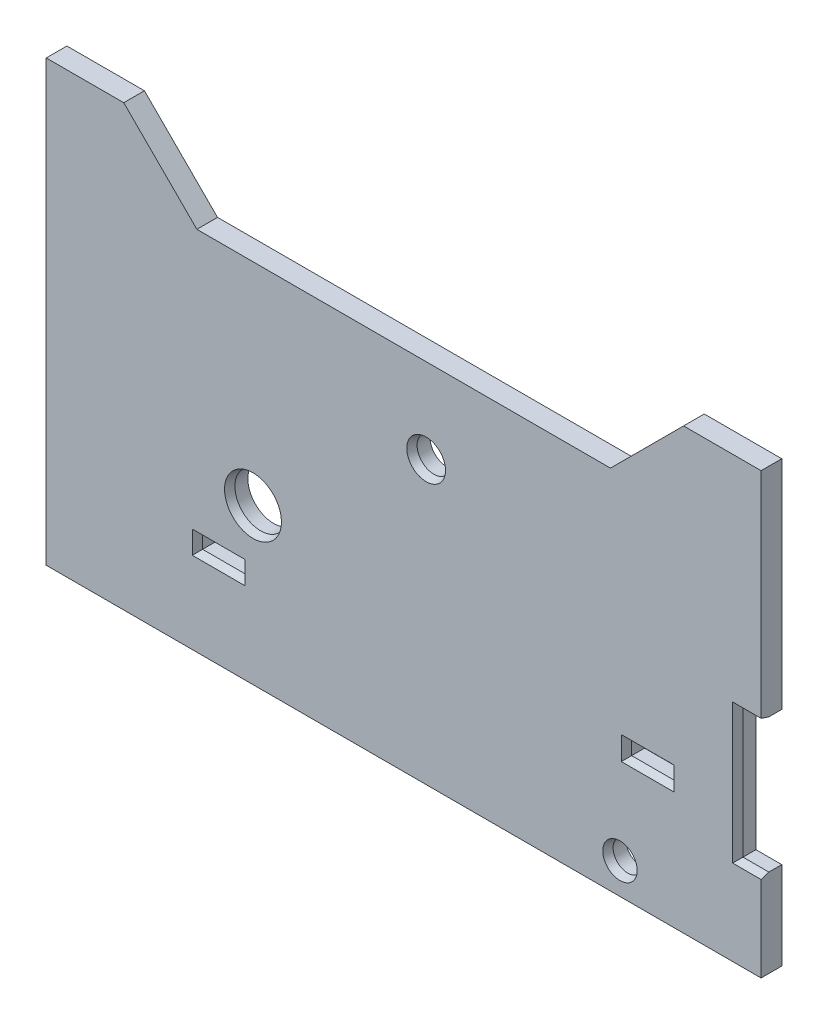
from build123d import *
from OCP.BRepFilletAPI import BRepFilletAPI_MakeChamfer

# Parameters (mm, degrees)
SKETCH1_R           = 5
SKETCH1_R_2         = 2.83
SKETCH1_R_3         = 3.25
SKETCH1_W           = 9.2
SKETCH1_H           = 3.53
SKETCH1_H_2         = 3.4
BOSS_EXTRUDE1_DEPTH = 2
BOSS_EXTRUDE2_DEPTH = 2
CHAMFER1_SIZE       = 0.5
CHAMFER1_SIZE2      = 1.5
CHAMFER2_SIZE       = 1.5
CHAMFER2_SIZE2      = 0.5


with BuildPart() as part:
    # Sketch1 → Boss-Extrude1 (new, symmetric)
    with BuildSketch(Plane.XY):
        Polygon((-86, -30), (-86, 30), (52.3, 30), (52.3, 13), (47.3, 13), (47.3, -13), (52.3, -13), (52.3, -30), align=None)
        with Locations((-46, 0)):
            Circle(SKETCH1_R, mode=Mode.SUBTRACT)
        with Locations((25, -24)):
            Circle(SKETCH1_R_2, mode=Mode.SUBTRACT)
        with Locations((-12.5, 24.5)):
            Circle(SKETCH1_R_3, mode=Mode.SUBTRACT)
        with Locations((30.35, -5)):
            Rectangle(SKETCH1_W, SKETCH1_H, mode=Mode.SUBTRACT)
        with Locations((-52.65, -12)):
            Rectangle(SKETCH1_W, SKETCH1_H_2, mode=Mode.SUBTRACT)
    extrude(amount=BOSS_EXTRUDE1_DEPTH, both=True)

    # Sketch2 → Boss-Extrude2 (add, symmetric)
    with BuildSketch(Plane.XY):
        Polygon((-86, 30), (52.3, 30), (52.3, 55), (37.3, 55), (23.157864376, 40.857864376), (-56.857864376, 40.857864376), (-71, 55), (-86, 55), align=None)
    extrude(amount=BOSS_EXTRUDE2_DEPTH, both=True)

    # Chamfer1
    chamfer1_edges = [part.edges().sort_by_distance(p)[0] for p in [
        (22.17, -24, 2),
        (30.35, -6.765, 2),
        (25.75, -5, 2),
        (30.35, -3.235, 2),
        (34.95, -5, 2),
        (-48.05, -12, 2),
        (-52.65, -13.7, 2),
        (-57.25, -12, 2),
        (-52.65, -10.3, 2),
        (-51, 0, 2),
        (-15.75, 24.5, 2),
    ]]
    chamfer1_side = [part.faces().sort_by_distance(p)[0] for p in [
        (-17.641163969, 8.221234178, 2),
    ]]
    chamfer(chamfer1_edges, length=CHAMFER1_SIZE, length2=CHAMFER1_SIZE2, reference=chamfer1_side[0])

    # Chamfer2: one chamfer whose edges measure the first distance from different faces: ONE call of the kernel's chamfer builder (chamfer() names one face for all edges)
    chamfer2_edges_1 = [part.edges().sort_by_distance(p)[0] for p in [
        (49.8, -13, 2),
    ]]
    chamfer2_side_1 = [part.faces().sort_by_distance(p)[0] for p in [
        (49.8, -13, 0),
    ]]
    chamfer2_edges_2 = [part.edges().sort_by_distance(p)[0] for p in [
        (47.3, 0, 2),
    ]]
    chamfer2_side_2 = [part.faces().sort_by_distance(p)[0] for p in [
        (47.3, 0, 0),
    ]]
    chamfer2_edges_3 = [part.edges().sort_by_distance(p)[0] for p in [
        (49.8, 13, 2),
    ]]
    chamfer2_side_3 = [part.faces().sort_by_distance(p)[0] for p in [
        (49.8, 13, 0),
    ]]
    chamfer2 = BRepFilletAPI_MakeChamfer(part.part.solid().wrapped)
    for e in chamfer2_edges_1:
        chamfer2.Add(CHAMFER2_SIZE, CHAMFER2_SIZE2, e.wrapped, chamfer2_side_1[0].wrapped)  # the first distance lies on this face
    for e in chamfer2_edges_2:
        chamfer2.Add(CHAMFER2_SIZE, CHAMFER2_SIZE2, e.wrapped, chamfer2_side_2[0].wrapped)  # the first distance lies on this face
    for e in chamfer2_edges_3:
        chamfer2.Add(CHAMFER2_SIZE, CHAMFER2_SIZE2, e.wrapped, chamfer2_side_3[0].wrapped)  # the first distance lies on this face
    add(Compound.cast(chamfer2.Shape()), mode=Mode.REPLACE)


solid = part.part
